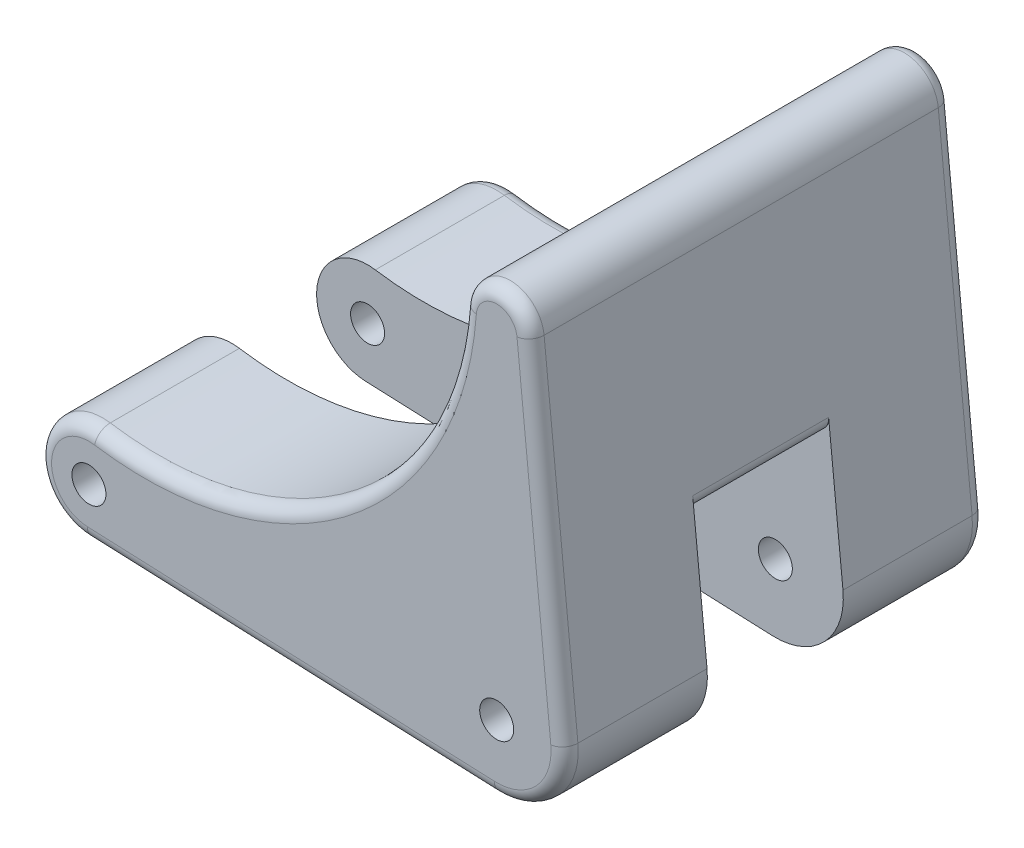
from build123d import *

# Parameters (mm, degrees)
SKETCH1_R           = 3.175
BOSS_EXTRUDE1_DEPTH = 39.37
SKETCH3_W           = 153.048335432
SKETCH3_H           = 25.4
CUT_EXTRUDE1_DEPTH  = 38.1
FILLET1_R           = 2.54
FILLET2_R           = 2.54


with BuildPart() as part:
    # Sketch1 → Boss-Extrude1 (new, symmetric)
    with BuildSketch(Plane.XY):
        with BuildLine():
            Line((-76.596875, -9.516728179), (-0.529166667, -12.688970905))
            ThreePointArc((-0.529166667, -12.688970905), (9.239000565, -8.713832025), (12.636340451, 1.27))
            Line((12.636340451, 1.27), (6.318170226, 64.135))
            ThreePointArc((6.318170226, 64.135), (-0.08833437, 69.849385564), (-6.333390084, 63.95898807))
            ThreePointArc((-6.333390084, 63.95898807), (-28.602299903, 21.707467551), (-74.754015102, 9.414603161))
            ThreePointArc((-74.754015102, 9.414603161), (-85.680189052, 0.922843719), (-76.596875, -9.516728179))
        make_face()
        with Locations((-76.2, 0)):
            Circle(SKETCH1_R, mode=Mode.SUBTRACT)
        Circle(SKETCH1_R, mode=Mode.SUBTRACT)
    extrude(amount=BOSS_EXTRUDE1_DEPTH, both=True)

    # Sketch3 → Cut-Extrude1 (cut)
    with BuildSketch(Plane(origin=(-0.529166667, -12.688970905, 0), x_dir=(0.9991315673568165, -0.04166666666666664, 0), z_dir=(-0.04166666666666664, -0.9991315673568165, 0))):
        with Locations((-41.471397415, 0)):
            Rectangle(SKETCH3_W, SKETCH3_H)
    extrude(amount=-CUT_EXTRUDE1_DEPTH, mode=Mode.SUBTRACT)

    # Fillet1
    fillet1_edges = [part.edges().sort_by_distance(p)[0] for p in [
        (-23.382807479, 26.397207842, 0),
        (10.25193425, 24.994542149, 0),
    ]]
    fillet(fillet1_edges, radius=FILLET1_R)

    # Fillet2
    fillet2_edges = [part.edges().sort_by_distance(p)[0] for p in [
        (-0.08833437, 69.849385564, -39.37),
        (9.477255338, 32.7025, -39.37),
        (9.239000565, -8.713832025, -39.37),
        (-38.563020833, -11.102849542, -39.37),
        (-85.680189052, 0.922843719, -39.37),
        (-0.08833437, 69.849385564, 39.37),
        (9.477255338, 32.7025, 39.37),
        (9.239000565, -8.713832025, 39.37),
        (-38.563020833, -11.102849542, 39.37),
        (-85.680189052, 0.922843719, 39.37),
        (-28.602299903, 21.707467551, -39.37),
        (-28.602299903, 21.707467551, 39.37),
    ]]
    fillet(fillet2_edges, radius=FILLET2_R)


solid = part.part
